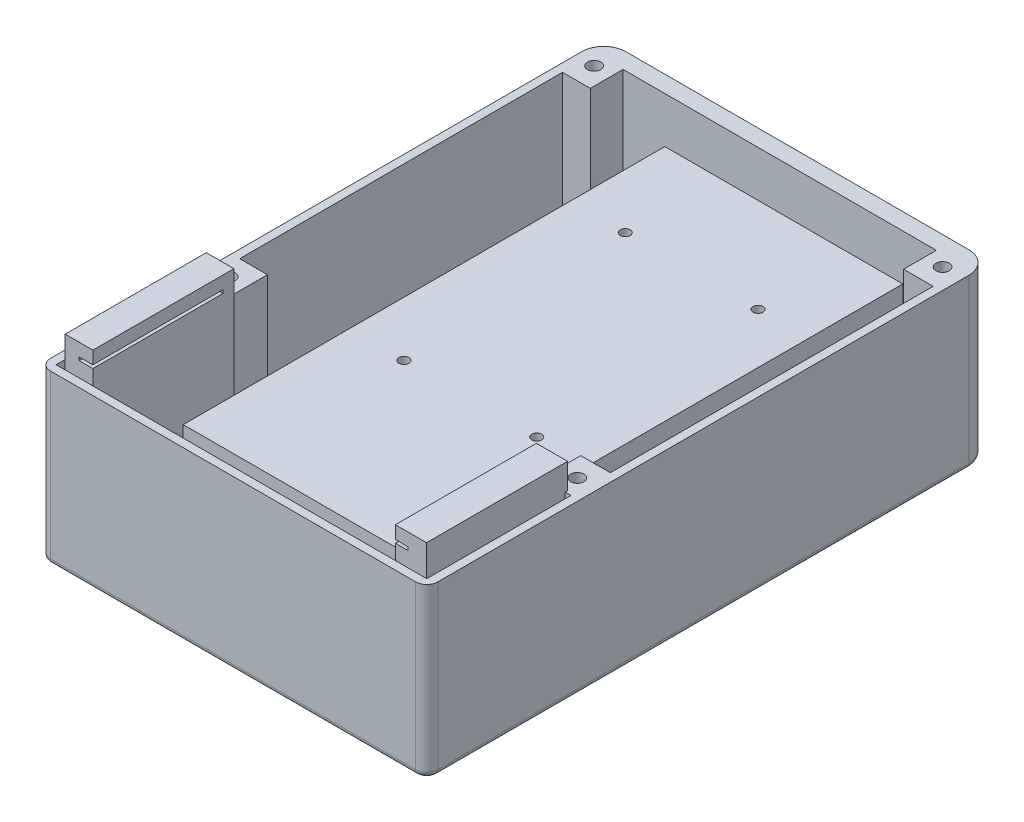
from build123d import *
from build123d.topology import SkipClean

# Parameters (mm, degrees)
SKETCH1_W                                            = 70
SKETCH1_H                                            = 102
BOSS_EXTRUDE1_DEPTH                                  = 2
SKETCH5_W                                            = 43.02
SKETCH5_H                                            = 87.056089095
BOSS_EXTRUDE3_DEPTH                                  = 24
SKETCH8_W                                            = 41.126198898
SKETCH8_H                                            = 88.35
CUT_EXTRUDE1_DEPTH                                   = 21.6
SKETCH9_W                                            = 102
SKETCH9_H                                            = 30.390592434
BOSS_EXTRUDE4_DEPTH                                  = 1.5
SKETCH10_W                                           = 3.035434725
SKETCH10_H                                           = 30.390592434
BOSS_EXTRUDE5_DEPTH                                  = 70
SKETCH12_W                                           = 70
SKETCH12_H                                           = 30.390592434
BOSS_EXTRUDE6_DEPTH                                  = 1.5
SKETCH13_W                                           = 1.5
SKETCH13_H                                           = 30.390592434
BOSS_EXTRUDE7_DEPTH                                  = 102
SKETCH14_W                                           = 5.822885906
SKETCH14_H                                           = 7.11645762
SKETCH14_W_2                                         = 6.522006055
SKETCH14_H_2                                         = 8.956155289
SKETCH14_W_3                                         = 6.847590119
SKETCH14_H_3                                         = 8.96
BOSS_EXTRUDE8_DEPTH                                  = 30.390592
CSK_FOR_M2_FLAT_HEAD_MACHINE_SCREW2_D                = 2.4
CSK_FOR_M2_FLAT_HEAD_MACHINE_SCREW2_CSINK_D          = 4.4
CSK_FOR_M2_FLAT_HEAD_MACHINE_SCREW2_CSINK_ANGLE      = 90
FILLET3_R                                            = 4
FILLET4_R                                            = 1
CSK_FOR_M1_6_CROSS_RECESS_FLAT_HEAD_SCRE_D           = 1.8
CSK_FOR_M1_6_CROSS_RECESS_FLAT_HEAD_SCRE_CSINK_D     = 3.6
CSK_FOR_M1_6_CROSS_RECESS_FLAT_HEAD_SCRE_CSINK_ANGLE = 90
SKETCH25_W                                           = 5.0026108
SKETCH25_H                                           = 25.5
SKETCH25_W_2                                         = 5.629250098
BOSS_EXTRUDE11_DEPTH                                 = 35
FILLET5_R                                            = 2
SKETCH43_W                                           = 59.408907714
SKETCH43_H                                           = 0.574758198
CUT_EXTRUDE6_DEPTH                                   = 26


with BuildPart() as part:
    # Sketch1 → Boss-Extrude1 (new body)
    with BuildSketch(Plane(origin=(0, 0, 0), x_dir=(1, 0, 0), z_dir=(0, 1, 0))):
        with Locations((35, 51)):
            Rectangle(SKETCH1_W, SKETCH1_H)
    extrude(amount=BOSS_EXTRUDE1_DEPTH)

    # Sketch5 → Boss-Extrude3 (add)
    with BuildSketch(Plane(origin=(0, 0, 0), x_dir=(1, 0, 0), z_dir=(0, 1, 0))):
        with Locations((37.49, 53.528044548)):
            Rectangle(SKETCH5_W, SKETCH5_H)
    extrude(amount=BOSS_EXTRUDE3_DEPTH)

    # Sketch8 → Cut-Extrude1 (cut)
    with BuildSketch(Plane(origin=(0, 0, 0), x_dir=(1, 0, 0), z_dir=(0, 1, 0))):
        with Locations((38.31859696, 54.175)):
            Rectangle(SKETCH8_W, SKETCH8_H)
    extrude(amount=CUT_EXTRUDE1_DEPTH, mode=Mode.SUBTRACT)

    # Sketch9 → Boss-Extrude4 (add)
    with BuildSketch(Plane(origin=(0, 0, 0), x_dir=(0, 0, -1), z_dir=(1, 0, 0))):
        with Locations((51, 15.195296217)):
            Rectangle(SKETCH9_W, SKETCH9_H)
    extrude(amount=BOSS_EXTRUDE4_DEPTH)

    # Sketch10 → Boss-Extrude5 (add)
    with BuildSketch(Plane(origin=(0, 0, 0), x_dir=(0, 0, -1), z_dir=(1, 0, 0))):
        with Locations((100.482282638, 15.195296217)):
            Rectangle(SKETCH10_W, SKETCH10_H)
    extrude(amount=BOSS_EXTRUDE5_DEPTH)

    # Sketch12 → Boss-Extrude6 (add)
    with BuildSketch(Plane.XY):
        with Locations((35, 15.195296217)):
            Rectangle(SKETCH12_W, SKETCH12_H)
    extrude(amount=-BOSS_EXTRUDE6_DEPTH)

    # Sketch13 → Boss-Extrude7 (add)
    with BuildSketch(Plane.XY):
        with Locations((69.25, 15.195296217)):
            Rectangle(SKETCH13_W, SKETCH13_H)
    extrude(amount=-BOSS_EXTRUDE7_DEPTH)

    # Sketch14 → Boss-Extrude8 (add, through all)
    with SkipClean():  # the faces are left unmerged after this step: merging them gives an invalid solid
        with BuildSketch(Plane(origin=(0, 0, 0), x_dir=(1, 0, 0), z_dir=(0, 1, 0))):
            with Locations((3.610563102, 31.130117345)):
                Rectangle(SKETCH14_W, SKETCH14_H)
            with Locations((3.261003028, 97.521922356)):
                Rectangle(SKETCH14_W_2, SKETCH14_H_2)
            with Locations((66.576204941, 97.52)):
                Rectangle(SKETCH14_W_3, SKETCH14_H_3)
            with Locations((66.576204941, 31.130117345)):
                Rectangle(SKETCH14_W_3, SKETCH14_H)
        extrude(amount=BOSS_EXTRUDE8_DEPTH)

    # CSK for M2 Flat Head Machine Screw2 (through all)
    with Locations(Plane(origin=(0, 0, 0), x_dir=(-1, 0, 0), z_dir=(0, -1, 0))):
        with Locations((-3.337466445, 96.913768876), (-66.331395266, 96.913768876), (-66.331395266, 30.887737285), (-3.337466445, 30.887737285)):
            CounterSinkHole(CSK_FOR_M2_FLAT_HEAD_MACHINE_SCREW2_D / 2, CSK_FOR_M2_FLAT_HEAD_MACHINE_SCREW2_CSINK_D / 2, counter_sink_angle=CSK_FOR_M2_FLAT_HEAD_MACHINE_SCREW2_CSINK_ANGLE)

    # Fillet3
    # the kernel refuses this fillet: 4 mm, written as the material it takes off along each edge
    with BuildSketch(Plane(origin=(0, 40.390592, -102), x_dir=(0, 0, 1), z_dir=(0, -1, 0))) as fillet3_piece_1_section:
        with BuildLine():
            CenterArc((FILLET3_R, -FILLET3_R), FILLET3_R, 90, 90)
            Line((0, -FILLET3_R), (-FILLET3_R * 0.02, -FILLET3_R))
            Line((-FILLET3_R * 0.02, -FILLET3_R), (-FILLET3_R * 0.02, FILLET3_R * 0.02))
            Line((-FILLET3_R * 0.02, FILLET3_R * 0.02), (FILLET3_R, FILLET3_R * 0.02))
            Line((FILLET3_R, FILLET3_R * 0.02), (FILLET3_R, 0))
        make_face()
    fillet3_piece_1 = extrude(amount=40.390592, mode=Mode.PRIVATE)
    fillet3_piece_1 = split(fillet3_piece_1, bisect_by=Plane(origin=(0.905580457, 30.390592434, -101.094419543), z_dir=(0, -1, 0)), keep=Keep.TOP, mode=Mode.PRIVATE)
    add(fillet3_piece_1, mode=Mode.SUBTRACT)
    with BuildSketch(Plane(origin=(70, 0, -102), x_dir=(0, 0, 1), z_dir=(0, 1, 0))) as fillet3_piece_2_section:
        with BuildLine():
            CenterArc((FILLET3_R, -FILLET3_R), FILLET3_R, 90, 90)
            Line((0, -FILLET3_R), (-FILLET3_R * 0.02, -FILLET3_R))
            Line((-FILLET3_R * 0.02, -FILLET3_R), (-FILLET3_R * 0.02, FILLET3_R * 0.02))
            Line((-FILLET3_R * 0.02, FILLET3_R * 0.02), (FILLET3_R, FILLET3_R * 0.02))
            Line((FILLET3_R, FILLET3_R * 0.02), (FILLET3_R, 0))
        make_face()
    fillet3_piece_2 = extrude(amount=40.390592, mode=Mode.PRIVATE)
    fillet3_piece_2 = split(fillet3_piece_2, bisect_by=Plane(origin=(69.094419543, 30.390592434, -101.094419543), z_dir=(0, -1, 0)), keep=Keep.TOP, mode=Mode.PRIVATE)
    add(fillet3_piece_2, mode=Mode.SUBTRACT)

    # Fillet4
    # the kernel refuses this fillet: 1 mm, written as the material it adds along each edge
    with BuildSketch(Plane(origin=(65.652409881, 2, -98.964565275), x_dir=(0, 1, 0), z_dir=(-1, 0, 0))) as fillet4_piece_1_section:
        with BuildLine():
            CenterArc((FILLET4_R, -FILLET4_R), FILLET4_R, 90, 90)
            Line((0, -FILLET4_R), (0, 0))
            Line((0, 0), (FILLET4_R, 0))
        make_face()
    fillet4_piece_1 = extrude(amount=61.630403826, mode=Mode.PRIVATE)
    fillet4_piece_1 = split(fillet4_piece_1, bisect_by=Plane(origin=(61.017053145, 2.232922343, -98.35), z_dir=(0, 0, -1)), keep=Keep.TOP, mode=Mode.PRIVATE)
    add(fillet4_piece_1)
    with BuildSketch(Plane(origin=(65.652409881, 2, -98.964565275), x_dir=(0, 1, 0), z_dir=(-1, 0, 0))) as fillet4_piece_2_section:
        with BuildLine():
            CenterArc((FILLET4_R, -FILLET4_R), FILLET4_R, 90, 90)
            Line((0, -FILLET4_R), (0, 0))
            Line((0, 0), (FILLET4_R, 0))
        make_face()
    fillet4_piece_2 = extrude(amount=61.630403826, mode=Mode.PRIVATE)
    fillet4_piece_2 = split(fillet4_piece_2, bisect_by=Plane(origin=(58.881696409, 2.02301744, -98.254401579), z_dir=(1, 0, 0)), keep=Keep.TOP, mode=Mode.PRIVATE)
    add(fillet4_piece_2)
    with BuildSketch(Plane(origin=(65.652409881, 2, -98.964565275), x_dir=(0, 1, 0), z_dir=(-1, 0, 0))) as fillet4_piece_3_section:
        with BuildLine():
            CenterArc((FILLET4_R, -FILLET4_R), FILLET4_R, 90, 90)
            Line((0, -FILLET4_R), (0, 0))
            Line((0, 0), (FILLET4_R, 0))
        make_face()
    fillet4_piece_3 = extrude(amount=61.630403826, mode=Mode.PRIVATE)
    fillet4_piece_3 = split(fillet4_piece_3, bisect_by=Plane(origin=(17.755497511, 2.02301744, -98.254401579), z_dir=(-1, 0, 0)), keep=Keep.TOP, mode=Mode.PRIVATE)
    add(fillet4_piece_3)
    # the kernel refuses this fillet: 1 mm, written as the material it takes off along each edge
    with BuildSketch(Plane(origin=(4, 0, -98), x_dir=(-1, 0, 0), z_dir=(0, 0, 1))) as fillet4_2_piece_1:
        with BuildLine():
            CenterArc((4 - FILLET4_R, -FILLET4_R), FILLET4_R, 0, 90)
            Line((4, -FILLET4_R), (4, 0))
            Line((4, 0), (4 - FILLET4_R, 0))
        make_face()
    revolve(axis=Axis((4, 0, -98), (0, -1, 0)), revolution_arc=90, mode=Mode.SUBTRACT)
    with BuildSketch(Plane(origin=(6.522006055, 0, -102), x_dir=(0, 0, 1), z_dir=(1, 0, 0))) as fillet4_2_piece_2:
        with BuildLine():
            CenterArc((FILLET4_R, -FILLET4_R), FILLET4_R, 90, 90)
            Line((0, -FILLET4_R), (0, 0))
            Line((0, 0), (FILLET4_R, 0))
        make_face()
    extrude(amount=56.630403826, mode=Mode.SUBTRACT)
    with BuildSketch(Plane(origin=(66, 0, -98), x_dir=(1, 0, 0), z_dir=(0, 0, 1))) as fillet4_2_piece_3:
        with BuildLine():
            CenterArc((4 - FILLET4_R, FILLET4_R), FILLET4_R, 270, 90)
            Line((4, FILLET4_R), (4, 0))
            Line((4, 0), (4 - FILLET4_R, 0))
        make_face()
    revolve(axis=Axis((66, 0, -98), (0, 1, 0)), revolution_arc=90, mode=Mode.SUBTRACT)
    with BuildSketch(Plane(origin=(70, 0, -93.04), x_dir=(-1, 0, 0), z_dir=(0, 0, 1))) as fillet4_2_piece_4:
        with BuildLine():
            CenterArc((FILLET4_R, -FILLET4_R), FILLET4_R, 90, 90)
            Line((0, -FILLET4_R), (0, 0))
            Line((0, 0), (FILLET4_R, 0))
        make_face()
    extrude(amount=58.351653845, mode=Mode.SUBTRACT)
    with BuildSketch(Plane(origin=(0, 0, 2.5), x_dir=(1, 0, 0), z_dir=(0, 0, -1))) as fillet4_2_piece_5:
        with BuildLine():
            CenterArc((FILLET4_R, -FILLET4_R), FILLET4_R, 90, 90)
            Line((0, -FILLET4_R), (0, 0))
            Line((0, 0), (FILLET4_R, 0))
        make_face()
    extrude(amount=95.543844711, mode=Mode.SUBTRACT)
    with BuildSketch(Plane(origin=(-2.5, 0, 0), x_dir=(0, 1, 0), z_dir=(1, 0, 0))) as fillet4_2_piece_6:
        with BuildLine():
            CenterArc((FILLET4_R, -FILLET4_R), FILLET4_R, 90, 90)
            Line((0, -FILLET4_R), (0, 0))
            Line((0, 0), (FILLET4_R, 0))
        make_face()
    extrude(amount=75, mode=Mode.SUBTRACT)
    with BuildSketch(Plane(origin=(0, 0, -93.043844711), x_dir=(1, 0, 0), z_dir=(0, 0, -1))) as fillet4_2_piece_7:
        with BuildLine():
            CenterArc((FILLET4_R, -FILLET4_R), FILLET4_R, 90, 90)
            Line((0, -FILLET4_R), (0, 0))
            Line((0, 0), (FILLET4_R, 0))
        make_face()
    extrude(amount=4.956155289, mode=Mode.SUBTRACT)
    with BuildSketch(Plane(origin=(70, 0, -98), x_dir=(-1, 0, 0), z_dir=(0, 0, 1))) as fillet4_2_piece_8:
        with BuildLine():
            CenterArc((FILLET4_R, -FILLET4_R), FILLET4_R, 90, 90)
            Line((0, -FILLET4_R), (0, 0))
            Line((0, 0), (FILLET4_R, 0))
        make_face()
    extrude(amount=4.96, mode=Mode.SUBTRACT)
    with BuildSketch(Plane(origin=(70, 0, -27.571888535), x_dir=(-1, 0, 0), z_dir=(0, 0, -1))) as fillet4_2_piece_9:
        with BuildLine():
            CenterArc((FILLET4_R, FILLET4_R), FILLET4_R, 180, 90)
            Line((0, FILLET4_R), (0, 0))
            Line((0, 0), (FILLET4_R, 0))
        make_face()
    extrude(amount=7.11645762, mode=Mode.SUBTRACT)
    with BuildSketch(Plane(origin=(70, 0, -27.571888535), x_dir=(-1, 0, 0), z_dir=(0, 0, 1))) as fillet4_2_piece_10:
        with BuildLine():
            CenterArc((FILLET4_R, -FILLET4_R), FILLET4_R, 90, 90)
            Line((0, -FILLET4_R), (0, 0))
            Line((0, 0), (FILLET4_R, 0))
        make_face()
    extrude(amount=30.071888535, mode=Mode.SUBTRACT)
    with BuildSketch(Plane(origin=(63.152409881, 0, -102), x_dir=(0, 0, 1), z_dir=(1, 0, 0))) as fillet4_2_piece_11:
        with BuildLine():
            CenterArc((FILLET4_R, -FILLET4_R), FILLET4_R, 90, 90)
            Line((0, -FILLET4_R), (0, 0))
            Line((0, 0), (FILLET4_R, 0))
        make_face()
    extrude(amount=2.847590119, mode=Mode.SUBTRACT)
    with BuildSketch(Plane(origin=(4, 0, -102), x_dir=(0, 0, 1), z_dir=(1, 0, 0))) as fillet4_2_piece_12:
        with BuildLine():
            CenterArc((FILLET4_R, -FILLET4_R), FILLET4_R, 90, 90)
            Line((0, -FILLET4_R), (0, 0))
            Line((0, 0), (FILLET4_R, 0))
        make_face()
    extrude(amount=2.522006055, mode=Mode.SUBTRACT)

    # CSK for M1.6 Cross Recess Flat Head Screw1 (through all)
    with Locations(Plane(origin=(0, 21.6, 0), x_dir=(-1, 0, 0), z_dir=(0, -1, 0))):
        with Locations((-25.881696409, 40), (-49.881696409, 40), (-25.881696409, 80), (-49.881696409, 80)):
            CounterSinkHole(CSK_FOR_M1_6_CROSS_RECESS_FLAT_HEAD_SCRE_D / 2, CSK_FOR_M1_6_CROSS_RECESS_FLAT_HEAD_SCRE_CSINK_D / 2, counter_sink_angle=CSK_FOR_M1_6_CROSS_RECESS_FLAT_HEAD_SCRE_CSINK_ANGLE)

    # Sketch25 → Boss-Extrude11 (add)
    with SkipClean():  # the faces are left unmerged after this step: merging them gives an invalid solid
        with BuildSketch(Plane(origin=(0, 0, 0), x_dir=(1, 0, 0), z_dir=(0, 1, 0))):
            with Locations((4.650455707, 15.25)):
                Rectangle(SKETCH25_W, SKETCH25_H)
            with Locations((64.64243864, 15.25)):
                Rectangle(SKETCH25_W_2, SKETCH25_H)
        extrude(amount=BOSS_EXTRUDE11_DEPTH)

    # Fillet5
    # the kernel refuses this fillet: 2 mm, written as the material it takes off along each edge
    with BuildSketch(Plane(origin=(2, 0, -2), x_dir=(0, 0, 1), z_dir=(1, 0, 0))) as fillet5_piece_1:
        with BuildLine():
            CenterArc((1, -1), 1, 0, 90)
            Line((2, -1), (2, 0))
            Line((2, 0), (1, 0))
        make_face()
    revolve(axis=Axis((2, 0, -2), (0, -1, 0)), revolution_arc=90, mode=Mode.SUBTRACT)
    with BuildSketch(Plane(origin=(68, 0, -2), x_dir=(1, 0, 0), z_dir=(0, 0, -1))) as fillet5_piece_2:
        with BuildLine():
            CenterArc((1, -1), 1, 0, 90)
            Line((2, -1), (2, 0))
            Line((2, 0), (1, 0))
        make_face()
    revolve(axis=Axis((68, 0, -2), (0, -1, 0)), revolution_arc=90, mode=Mode.SUBTRACT)
    with BuildSketch(Plane(origin=(70, 0, 0), x_dir=(0, 0, -1), z_dir=(0, 1, 0)), Plane(origin=(0, 35.390592434, 0), x_dir=(0, 0, -1), z_dir=(0, -1, 0))) as fillet5_piece_3:
        with BuildLine():
            CenterArc((FILLET5_R, FILLET5_R), FILLET5_R, 180, 90)
            Line((0, FILLET5_R), (0, 0))
            Line((0, 0), (FILLET5_R, 0))
        make_face()
    extrude(amount=35.390592434, mode=Mode.SUBTRACT)

    # Sketch43 → Cut-Extrude6 (cut)
    with SkipClean():  # the faces are left unmerged after this step: merging them gives an invalid solid
        with BuildSketch(Plane.XY):
            with Locations((34.375598891, 32.404898628)):
                Rectangle(SKETCH43_W, SKETCH43_H)
        extrude(amount=-CUT_EXTRUDE6_DEPTH, mode=Mode.SUBTRACT)


solid = part.part
